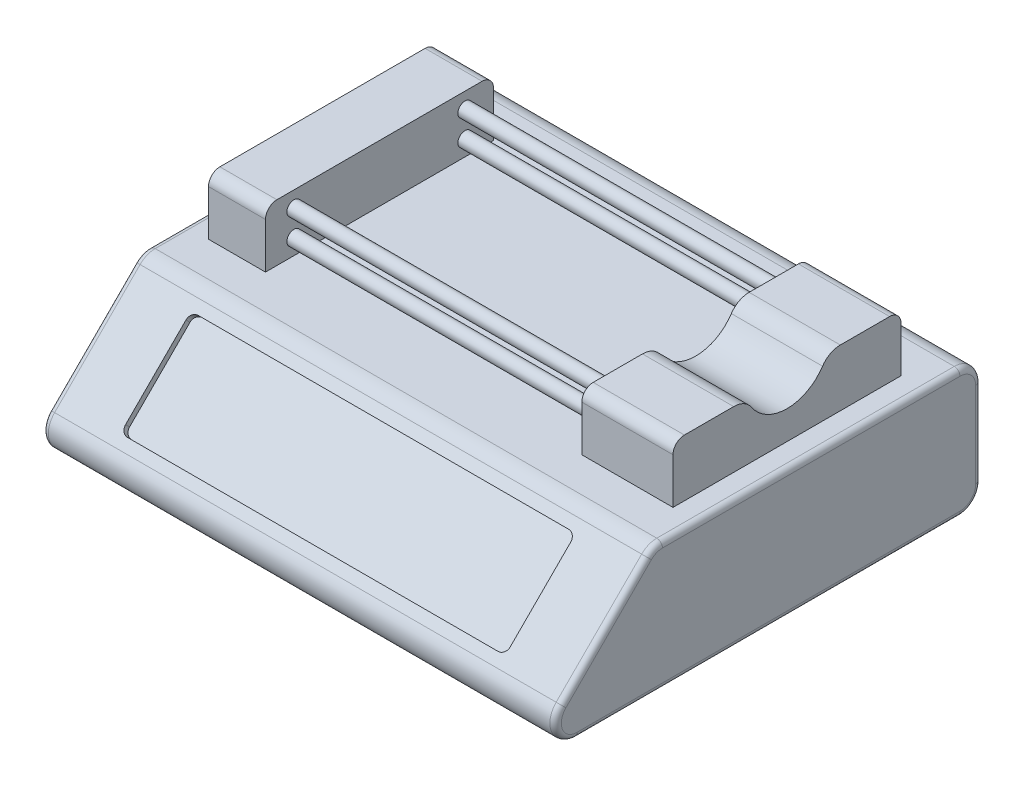
from build123d import *

# Parameters (mm, degrees)
BOSS_EXTRUDE1_DEPTH      = 90
FILLET1_R                = 7.5
FILLET2_R                = 2
SKETCH2_W                = 20
SKETCH2_H                = 80
SKETCH2_W_2              = 32
BOSS_EXTRUDE2_DEPTH      = 20
SKETCH3_R                = 2.5
BOSS_EXTRUDE3_DEPTH      = 111
BOSS_EXTRUDE4_START      = 7.5
SKETCH4_W                = 80
SKETCH4_H                = 20
SKETCH4_R                = 3.25
BOSS_EXTRUDE4_DEPTH      = 20
MOVE_FACE1_BY            = 1.5
MOVE_FACE2_BY            = 1.5
FILLET3_R                = 4
FILLET4_R                = 4
CUT_EXTRUDE1_DEPTH       = 2
BOSS_EXTRUDE5_DEPTH      = 2
SKETCH7_W                = 58
SKETCH7_H                = 15
CUT_EXTRUDE2_DEPTH       = 0.5
SKETCH8_R                = 10
BOSS_EXTRUDE6_DEPTH      = 1.5
SKETCH10_R               = 4.25
SKETCH10_R_2             = 2.75
CUT_EXTRUDE_THIN1_DEPTH  = 1.5
SKETCH11_RX              = 5
SKETCH11_RY              = 2.5
BOSS_EXTRUDE7_DEPTH      = 1.5
LPATTERN1_COUNT          = 3
LPATTERN1_PITCH          = 24
SKETCH12_RX              = 5
SKETCH12_RY              = 2.5
BOSS_EXTRUDE8_DEPTH      = 1.5
LPATTERN2_START          = 113.13708499
LPATTERN2_DEPTH          = 1.5
FILLET7_R                = 7.5
FILLET5_R                = 5
FILLET6_R                = 2
SHELL1_T                 = -1
SKETCH14_R               = 14
BOSS_EXTRUDE9_DEPTH      = 1
BOSS_EXTRUDE10_DEPTH     = 1
BOSS_EXTRUDE11_START     = -30
BOSS_EXTRUDE11_OUTLINE_R = 13
BOSS_EXTRUDE11_DEPTH     = 10
BOSS_EXTRUDE12_REACH     = 233.484
SKETCH18_R               = 3
SKETCH17_W               = 1.5
SKETCH17_H               = 20
SKETCH17_W_2             = 20
SKETCH17_H_2             = 1.5
EXTRUDE_THIN1_DEPTH      = 63.5
SKETCH20_R               = 12.5
BOSS_EXTRUDE13_DEPTH     = 5
FILLET8_R                = 2


# Read off the part's stored shape, not the designer's step: LPattern2, Body-Move/Copy1, Boss-Extrude11
with BuildPart() as part:
    # Sketch1 → Boss-Extrude1 (new, symmetric)
    with BuildSketch(Plane(origin=(0, 0, 0), x_dir=(0, 0, -1), z_dir=(1, 0, 0))):
        Polygon((0, 0), (0, 45), (-115, 45), (-160, 0), align=None)
    extrude(amount=BOSS_EXTRUDE1_DEPTH, both=True)

    # Fillet1
    fillet1_edges = [part.edges().sort_by_distance(p)[0] for p in [
        (0, 0, 160),
        (0, 45, 115),
        (0, 45, 0),
        (0, 0, 0),
    ]]
    fillet(fillet1_edges, radius=FILLET1_R)

    # Fillet2
    fillet2_edges = [part.edges().sort_by_distance(p)[0] for p in [
        (-90, 0, 74.696699141),
        (90, 0, 74.696699141),
        (-90, 27.803300859, 132.196699141),
        (-90, 45, 59.696699141),
        (-90, 22.5, 0),
        (-90, 44.429096494, 114.763524025),
        (-90, 2.196699141, 2.196699141),
        (-90, 42.803300859, 2.196699141),
        (-90, 4.629874257, 148.822494776),
        (90, 27.803300859, 132.196699141),
        (90, 22.5, 0),
        (90, 45, 59.696699141),
        (90, 44.429096494, 114.763524025),
        (90, 2.196699141, 2.196699141),
        (90, 42.803300859, 2.196699141),
        (90, 4.629874257, 148.822494776),
    ]]
    fillet(fillet2_edges, radius=FILLET2_R)

    # Sketch2 → Boss-Extrude2 (add)
    with BuildSketch(Plane(origin=(0, 45, 0), x_dir=(1, 0, 0), z_dir=(0, 1, 0))):
        with Locations((-71.5, -59.696699141)):
            Rectangle(SKETCH2_W, SKETCH2_H)
        with Locations((65.5, -59.696699141)):
            Rectangle(SKETCH2_W_2, SKETCH2_H)
    extrude(amount=BOSS_EXTRUDE2_DEPTH)

    # Sketch3 → Boss-Extrude3 (add)
    with BuildSketch(Plane(origin=(-61.5, 0, 0), x_dir=(0, 0, -1), z_dir=(1, 0, 0))):
        with Locations(Location((-89.696699141, 59.5, 0), (0, 0, 180))):
            Circle(SKETCH3_R)
        with Locations(Location((-89.696699141, 50.5, 0), (0, 0, 180))):
            Circle(SKETCH3_R)
        with Locations(Location((-29.696699141, 50.5, 0), (0, 0, 180))):
            Circle(SKETCH3_R)
        with Locations(Location((-29.696699141, 59.5, 0), (0, 0, 180))):
            Circle(SKETCH3_R)
    extrude(amount=BOSS_EXTRUDE3_DEPTH)

    # Fillet3
    fillet3_edges = [part.edges().sort_by_distance(p)[0] for p in [
        (65.5, 65, 99.696699141),
        (65.5, 65, 19.696699141),
        (-71.5, 65, 99.696699141),
        (-71.5, 65, 19.696699141),
    ]]
    fillet(fillet3_edges, radius=FILLET3_R)

    # Sketch5 → Cut-Extrude1 (cut)
    with BuildSketch(Plane(origin=(0, 80, 80), x_dir=(1, 0, 0), z_dir=(0, 0.7071067811865511, 0.707106781186544))):
        with BuildLine():
            Line((-65, -56.317279836), (65, -56.317279836))
            ThreePointArc((65, -56.317279836), (66.767766953, -57.049512883), (67.5, -58.817279836))
            Line((67.5, -58.817279836), (67.5, -88.817279836))
            ThreePointArc((67.5, -88.817279836), (66.767766953, -90.585046789), (65, -91.317279836))
            Line((65, -91.317279836), (-65, -91.317279836))
            ThreePointArc((-65, -91.317279836), (-66.767766953, -90.585046789), (-67.5, -88.817279836))
            Line((-67.5, -88.817279836), (-67.5, -58.817279836))
            ThreePointArc((-67.5, -58.817279836), (-66.767766953, -57.049512883), (-65, -56.317279836))
        make_face()
    extrude(amount=-CUT_EXTRUDE1_DEPTH, mode=Mode.SUBTRACT)


with BuildPart() as body_2:
    # Sketch4 → Boss-Extrude4 (new body)
    with BuildSketch(Plane(origin=(-61.5, 0, 0), x_dir=(0, 0, -1), z_dir=(1, 0, 0)).offset(BOSS_EXTRUDE4_START)):
        with Locations((-59.696699141, 55)):
            Rectangle(SKETCH4_W, SKETCH4_H)
        with Locations((-89.696699141, 59.5)):
            Circle(SKETCH4_R, mode=Mode.SUBTRACT)
        with Locations((-89.696699141, 50.5)):
            Circle(SKETCH4_R, mode=Mode.SUBTRACT)
        with Locations((-29.696699141, 59.5)):
            Circle(SKETCH4_R, mode=Mode.SUBTRACT)
        with Locations((-29.696699141, 50.5)):
            Circle(SKETCH4_R, mode=Mode.SUBTRACT)
    extrude(amount=BOSS_EXTRUDE4_DEPTH)

    # Move Face1: a face moved outward by 1.5
    extrude(body_2.faces().sort_by_distance((-44, 65, 59.696699141))[0], amount=MOVE_FACE1_BY, dir=(0, 1, 0))

    # Move Face2: a face moved inward by 1.5
    extrude(body_2.faces().sort_by_distance((-44, 45, 59.696699141))[0], amount=MOVE_FACE2_BY, dir=(0, 1, 0), mode=Mode.SUBTRACT)

    # Fillet4
    fillet4_edges = [body_2.edges().sort_by_distance(p)[0] for p in [
        (-44, 66.5, 99.696699141),
        (-44, 66.5, 19.696699141),
        (-44, 46.5, 19.696699141),
        (-44, 46.5, 99.696699141),
    ]]
    fillet(fillet4_edges, radius=FILLET4_R)


with BuildPart() as body_3:
    # Sketch6 → Boss-Extrude5 (new body)
    with BuildSketch(Plane(origin=(0, 78.585786438, 78.585786438), x_dir=(1, 0, 0), z_dir=(0, 0.7071067811865509, 0.7071067811865441))):
        with BuildLine():
            Line((65, -56.317279836), (-65, -56.317279836))
            ThreePointArc((-65, -56.317279836), (-66.767766953, -57.049512883), (-67.5, -58.817279836))
            Line((-67.5, -58.817279836), (-67.5, -88.817279836))
            ThreePointArc((-67.5, -88.817279836), (-66.767766953, -90.585046789), (-65, -91.317279836))
            Line((-65, -91.317279836), (65, -91.317279836))
            ThreePointArc((65, -91.317279836), (66.767766953, -90.585046789), (67.5, -88.817279836))
            Line((67.5, -88.817279836), (67.5, -58.817279836))
            ThreePointArc((67.5, -58.817279836), (66.767766953, -57.049512883), (65, -56.317279836))
        make_face()
    extrude(amount=BOSS_EXTRUDE5_DEPTH)

    # Sketch7 → Cut-Extrude2 (cut)
    with BuildSketch(Plane(origin=(0, 80, 80), x_dir=(1, 0, 0), z_dir=(0, 0.7071067811865509, 0.7071067811865441))):
        with Locations((-28.5, -71.817279836)):
            Rectangle(SKETCH7_W, SKETCH7_H)
    extrude(amount=-CUT_EXTRUDE2_DEPTH, mode=Mode.SUBTRACT)

    # Sketch8 → Boss-Extrude6 (add)
    with BuildSketch(Plane(origin=(0, 80, 80), x_dir=(1, 0, 0), z_dir=(0, 0.7071067811865509, 0.7071067811865441))):
        with Locations(Location((15.5, -71.817279836, 0), (0, 0, 270))):
            Circle(SKETCH8_R)
    extrude(amount=BOSS_EXTRUDE6_DEPTH)

    # Sketch10 → Cut-Extrude-Thin1 (cut)
    # profile 1 of 5: a face of its own
    with BuildSketch(Plane(origin=(0, 81.060660172, 81.060660172), x_dir=(1, 0, 0), z_dir=(0, 0.7071067811865509, 0.7071067811865441))):
        with Locations((15.5, -71.817279836)):
            Circle(SKETCH10_R)
        with Locations((15.5, -71.817279836)):
            Circle(SKETCH10_R_2, mode=Mode.SUBTRACT)
    # profile 2 of 5: a face of its own
    with BuildSketch(Plane(origin=(0, 81.060660172, 81.060660172), x_dir=(1, 0, 0), z_dir=(0, 0.7071067811865509, 0.7071067811865441))):
        Polygon((7.898602102, -65.27654211), (12.49479618, -69.872736188), (13.555456352, -68.812076016), (8.959262274, -64.215881939), align=None)
    # profile 3 of 5: a face of its own
    with BuildSketch(Plane(origin=(0, 81.060660172, 81.060660172), x_dir=(1, 0, 0), z_dir=(0, 0.7071067811865509, 0.7071067811865441))):
        Polygon((22.040737726, -64.215881939), (17.444543648, -68.812076016), (18.50520382, -69.872736188), (23.101397898, -65.27654211), align=None)
    # profile 4 of 5: a face of its own
    with BuildSketch(Plane(origin=(0, 81.060660172, 81.060660172), x_dir=(1, 0, 0), z_dir=(0, 0.7071067811865509, 0.7071067811865441))):
        Polygon((17.444543648, -74.822483656), (22.040737726, -79.418677734), (23.101397898, -78.358017562), (18.50520382, -73.761823485), align=None)
    # profile 5 of 5: a face of its own
    with BuildSketch(Plane(origin=(0, 81.060660172, 81.060660172), x_dir=(1, 0, 0), z_dir=(0, 0.7071067811865509, 0.7071067811865441))):
        Polygon((12.49479618, -73.761823485), (7.898602102, -78.358017562), (8.959262274, -79.418677734), (13.555456352, -74.822483656), align=None)
    extrude(amount=-CUT_EXTRUDE_THIN1_DEPTH, mode=Mode.SUBTRACT)

    # Sketch11 → Boss-Extrude7 (add)
    with BuildSketch(Plane(origin=(0, 80, 80), x_dir=(1, 0, 0), z_dir=(0, 0.7071067811865509, 0.7071067811865441))):
        with Locations((-52.5, -85.317279836)):
            Ellipse(SKETCH11_RX, SKETCH11_RY)
    boss_extrude7 = extrude(amount=BOSS_EXTRUDE7_DEPTH)

    # LPattern1: Boss-Extrude7 ×3
    with Locations(*[(i * LPATTERN1_PITCH, 0, 0) for i in range(1, LPATTERN1_COUNT)]):
        add(boss_extrude7)

    # Sketch12 → Boss-Extrude8 (add)
    with BuildSketch(Plane(origin=(0, 80, 80), x_dir=(1, 0, 0), z_dir=(0, 0.7071067811865509, 0.7071067811865441))):
        with Locations((32.5, -66.317279836)):
            Ellipse(SKETCH12_RX, SKETCH12_RY)
    extrude(amount=BOSS_EXTRUDE8_DEPTH)

    # LPattern2 outline → LPattern2 (add)
    with BuildSketch(Plane(origin=(0, 0, 0), x_dir=(1, 0, 0), z_dir=(0, 0.707106781186551, 0.7071067811865439)).offset(LPATTERN2_START)):
        with BuildLine():
            add(Edge.make_bspline(
                [(37.5, -74.317279836), (37.5, -69.987152818), (30, -72.152216327), (22.5, -74.317279836), (30, -76.482343346), (37.5, -78.647406855), (37.5, -74.317279836)],
                knots=[0, 0, 0, 2.094395102, 2.094395102, 4.188790205, 4.188790205, 6.283185307, 6.283185307, 6.283185307], degree=2, weights=[1, 0.5, 1, 0.5, 1, 0.5, 1]))
        make_face()
        with BuildLine():
            add(Edge.make_bspline(
                [(37.5, -82.317279836), (37.5, -77.987152818), (30, -80.152216327), (22.5, -82.317279836), (30, -84.482343346), (37.5, -86.647406855), (37.5, -82.317279836)],
                knots=[0, 0, 0, 2.094395102, 2.094395102, 4.188790205, 4.188790205, 6.283185307, 6.283185307, 6.283185307], degree=2, weights=[1, 0.5, 1, 0.5, 1, 0.5, 1]))
        make_face()
        with BuildLine():
            add(Edge.make_bspline(
                [(49.5, -66.317279836), (49.5, -61.987152818), (42, -64.152216327), (34.5, -66.317279836), (42, -68.482343346), (49.5, -70.647406855), (49.5, -66.317279836)],
                knots=[0, 0, 0, 2.094395102, 2.094395102, 4.188790205, 4.188790205, 6.283185307, 6.283185307, 6.283185307], degree=2, weights=[1, 0.5, 1, 0.5, 1, 0.5, 1]))
        make_face()
        with BuildLine():
            add(Edge.make_bspline(
                [(49.5, -74.317279836), (49.5, -69.987152818), (42, -72.152216327), (34.5, -74.317279836), (42, -76.482343346), (49.5, -78.647406855), (49.5, -74.317279836)],
                knots=[0, 0, 0, 2.094395102, 2.094395102, 4.188790205, 4.188790205, 6.283185307, 6.283185307, 6.283185307], degree=2, weights=[1, 0.5, 1, 0.5, 1, 0.5, 1]))
        make_face()
        with BuildLine():
            add(Edge.make_bspline(
                [(49.5, -82.317279836), (49.5, -77.987152818), (42, -80.152216327), (34.5, -82.317279836), (42, -84.482343346), (49.5, -86.647406855), (49.5, -82.317279836)],
                knots=[0, 0, 0, 2.094395102, 2.094395102, 4.188790205, 4.188790205, 6.283185307, 6.283185307, 6.283185307], degree=2, weights=[1, 0.5, 1, 0.5, 1, 0.5, 1]))
        make_face()
        with BuildLine():
            add(Edge.make_bspline(
                [(61.5, -66.317279836), (61.5, -61.987152818), (54, -64.152216327), (46.5, -66.317279836), (54, -68.482343346), (61.5, -70.647406855), (61.5, -66.317279836)],
                knots=[0, 0, 0, 2.094395102, 2.094395102, 4.188790205, 4.188790205, 6.283185307, 6.283185307, 6.283185307], degree=2, weights=[1, 0.5, 1, 0.5, 1, 0.5, 1]))
        make_face()
        with BuildLine():
            add(Edge.make_bspline(
                [(61.5, -74.317279836), (61.5, -69.987152818), (54, -72.152216327), (46.5, -74.317279836), (54, -76.482343346), (61.5, -78.647406855), (61.5, -74.317279836)],
                knots=[0, 0, 0, 2.094395102, 2.094395102, 4.188790205, 4.188790205, 6.283185307, 6.283185307, 6.283185307], degree=2, weights=[1, 0.5, 1, 0.5, 1, 0.5, 1]))
        make_face()
        with BuildLine():
            add(Edge.make_bspline(
                [(61.5, -82.317279836), (61.5, -77.987152818), (54, -80.152216327), (46.5, -82.317279836), (54, -84.482343346), (61.5, -86.647406855), (61.5, -82.317279836)],
                knots=[0, 0, 0, 2.094395102, 2.094395102, 4.188790205, 4.188790205, 6.283185307, 6.283185307, 6.283185307], degree=2, weights=[1, 0.5, 1, 0.5, 1, 0.5, 1]))
        make_face()
    extrude(amount=LPATTERN2_DEPTH)


with BuildPart() as body_4:
    # Sketch13 → Revolve1 (revolve)
    with BuildSketch(Plane.XY.offset(59.696699141), mode=Mode.PRIVATE) as revolve1_sk:
        Polygon((11.5, 70), (11.5, 85), (105.301145933, 85), (111.5, 74.263269807), (121.5, 72.5), (121.5, 70), align=None)
    revolve(revolve1_sk.sketch.rotate(Axis((11.5, 70, 59.696699141), (1, 0, 0)), 90), axis=Axis((11.5, 70, 59.696699141), (1, 0, 0)))

    # Fillet5
    fillet5_edges = [body_4.edges().sort_by_distance(p)[0] for p in [
        (105.301145933, 70, 44.696699141),
    ]]
    fillet(fillet5_edges, radius=FILLET5_R)

    # Fillet6
    fillet6_edges = [body_4.edges().sort_by_distance(p)[0] for p in [
        (111.5, 70, 55.433429334),
    ]]
    fillet(fillet6_edges, radius=FILLET6_R)

    # Shell1
    shell1_openings = [body_4.faces().sort_by_distance(p)[0] for p in [
        (121.5, 70, 59.696699141),
        (11.5, 70, 59.696699141),
    ]]
    offset(amount=SHELL1_T, openings=shell1_openings, kind=Kind.INTERSECTION)

    # Sketch14 → Boss-Extrude9 (add)
    with BuildSketch(Plane.ZY.offset(-11.5)):
        with BuildLine():
            Line((55.696699141, 85.491933385), (40.696699141, 81.618950039))
            ThreePointArc((40.696699141, 81.618950039), (31.696699141, 70), (40.696699141, 58.381049961))
            Line((40.696699141, 58.381049961), (55.696699141, 54.508066615))
            ThreePointArc((55.696699141, 54.508066615), (59.696699141, 54), (63.696699141, 54.508066615))
            Line((63.696699141, 54.508066615), (78.696699141, 58.381049961))
            ThreePointArc((78.696699141, 58.381049961), (87.696699141, 70), (78.696699141, 81.618950039))
            Line((78.696699141, 81.618950039), (63.696699141, 85.491933385))
            ThreePointArc((63.696699141, 85.491933385), (59.696699141, 86), (55.696699141, 85.491933385))
        make_face()
        with Locations((59.696699141, 70)):
            Circle(SKETCH14_R, mode=Mode.SUBTRACT)
    extrude(amount=BOSS_EXTRUDE9_DEPTH)


with BuildPart() as body_5:
    # Body-Move/Copy1 outline → Body-Move/Copy1 (revolve)
    with BuildSketch(Plane(origin=(0, 70, 59.696699141), x_dir=(0, 1, 0), z_dir=(0, 0, -1))):
        Polygon((0, 121.5), (0, 11.5), (15, 11.5), (15, 105.301145933), (4.263269807, 111.5), (2.5, 121.5), align=None)
    revolve(axis=Axis((0, 70, 59.696699141), (1, 0, 0)))


with BuildPart() as part_1:
    add(part.part)

    # Combine1: cut body 5
    add(body_5.part, mode=Mode.SUBTRACT)

    # Fillet7
    fillet7_edges = [part_1.edges().sort_by_distance(p)[0] for p in [
        (65.5, 65, 73.838834765),
        (65.5, 65, 45.554563517),
    ]]
    fillet(fillet7_edges, radius=FILLET7_R)

    # Sketch20 → Boss-Extrude13 (add)
    with BuildSketch(Plane.XZ):
        with Locations(Location((-60, 116.893398282, 0), (0, 0, 90))):
            Circle(SKETCH20_R)
        with Locations(Location((-60, 32.5, 0), (0, 0, 90))):
            Circle(SKETCH20_R)
        with Locations(Location((60, 32.5, 0), (0, 0, 90))):
            Circle(SKETCH20_R)
        with Locations(Location((60, 116.893398282, 0), (0, 0, 90))):
            Circle(SKETCH20_R)
    extrude(amount=BOSS_EXTRUDE13_DEPTH)

    # Fillet8
    fillet8_edges = [part_1.edges().sort_by_distance(p)[0] for p in [
        (-60, -5, 104.393398282),
        (-60, -5, 20),
        (60, -5, 20),
        (60, -5, 104.393398282),
    ]]
    fillet(fillet8_edges, radius=FILLET8_R)


with BuildPart() as body_5_2:
    # Sketch15 → Boss-Extrude10 (new body)
    with BuildSketch(Plane(origin=(-34, 0, 0), x_dir=(0, 0, -1), z_dir=(1, 0, 0))):
        with BuildLine():
            Line((-63.696699141, 85.491933385), (-78.696699141, 81.618950039))
            ThreePointArc((-78.696699141, 81.618950039), (-87.696699141, 70), (-78.696699141, 58.381049961))
            Line((-78.696699141, 58.381049961), (-63.696699141, 54.508066615))
            ThreePointArc((-63.696699141, 54.508066615), (-59.696699141, 54), (-55.696699141, 54.508066615))
            Line((-55.696699141, 54.508066615), (-40.696699141, 58.381049961))
            ThreePointArc((-40.696699141, 58.381049961), (-31.696699141, 70), (-40.696699141, 81.618950039))
            Line((-40.696699141, 81.618950039), (-55.696699141, 85.491933385))
            ThreePointArc((-55.696699141, 85.491933385), (-59.696699141, 86), (-63.696699141, 85.491933385))
        make_face()
    extrude(amount=BOSS_EXTRUDE10_DEPTH)


with BuildPart() as body_6:
    # Boss-Extrude11 outline → Boss-Extrude11 (new body)
    with BuildSketch(Plane.ZY.offset(-10.5).offset(BOSS_EXTRUDE11_START)):
        with Locations((59.696699141, 70)):
            Circle(BOSS_EXTRUDE11_OUTLINE_R)
    extrude(amount=BOSS_EXTRUDE11_DEPTH)

    # Sketch18 → Boss-Extrude12 (add, up to next)
    with BuildSketch(Plane(origin=(-33, 0, 0), x_dir=(0, 0, -1), z_dir=(1, 0, 0)), mode=Mode.PRIVATE) as boss_extrude12_sk1:
        with Locations(Location((-59.696699141, 70, 0), (0, 0, 180))):
            Circle(SKETCH18_R)
    boss_extrude12_tool1 = extrude(boss_extrude12_sk1.sketch, amount=BOSS_EXTRUDE12_REACH, mode=Mode.PRIVATE) - body_6.part

    add(body_5_2.part)  # Boss-Extrude12 merges body 5 2
    add(boss_extrude12_tool1.solids().sort_by_distance((-33, 70, 59.696699))[0])

    # Sketch17 → Extrude-Thin1 (add)
    with BuildSketch(Plane(origin=(-33, 0, 0), x_dir=(0, 0, -1), z_dir=(1, 0, 0))):
        with Locations((-59.696699141, 70)):
            Rectangle(SKETCH17_W, SKETCH17_H)
        with Locations((-59.696699141, 70)):
            Rectangle(SKETCH17_W_2, SKETCH17_H_2)
    extrude(amount=EXTRUDE_THIN1_DEPTH)

    # Sketch19 → Cut-Revolve3 (revolve, cut)
    with BuildSketch(Plane.XY.offset(59.696699141), mode=Mode.PRIVATE) as cut_revolve3_sk:
        Polygon((-33, 76.452368755), (-18, 80), (-18, 81.618950039), (-33, 81.618950039), align=None)
    revolve(cut_revolve3_sk.sketch.rotate(Axis((111.5, 70, 59.696699141), (-1, 0, 0)), 270), axis=Axis((111.5, 70, 59.696699141), (-1, 0, 0)), mode=Mode.SUBTRACT)


solid = part_1.part
